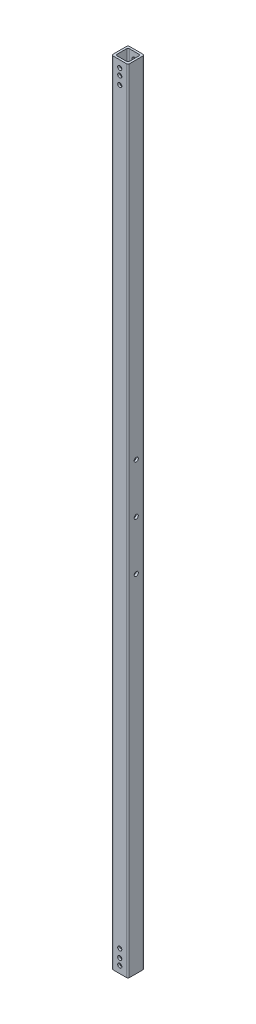
from build123d import *

# Parameters (mm, degrees)
SKETCH1_W           = 25.4
SKETCH1_H           = 25.4
SKETCH1_W_2         = 19.05
SKETCH1_H_2         = 19.05
BOSS_EXTRUDE1_DEPTH = 609.6
FILLET1_R           = 2.1082
SKETCH6_R           = 3.175
CUT_EXTRUDE5_DEPTH  = 611.261099858
SKETCH7_R           = 3.175
CUT_EXTRUDE6_DEPTH  = 611.261099858
SKETCH8_R           = 3.175
CUT_EXTRUDE7_DEPTH  = 611.261099858


with BuildPart() as part:
    # Sketch1 → Boss-Extrude1 (new, symmetric)
    with BuildSketch(Plane(origin=(0, 0, 0), x_dir=(1, 0, 0), z_dir=(0, 1, 0))):
        Rectangle(SKETCH1_W, SKETCH1_H)
        Rectangle(SKETCH1_W_2, SKETCH1_H_2, mode=Mode.SUBTRACT)
    extrude(amount=BOSS_EXTRUDE1_DEPTH, both=True)

    # Fillet1
    fillet1_edges = [part.edges().sort_by_distance(p)[0] for p in [
        (9.525, 0, -9.525),
        (-9.525, 0, -9.525),
        (-9.525, 0, 9.525),
        (9.525, 0, 9.525),
        (12.7, 0, -12.7),
        (-12.7, 0, -12.7),
        (-12.7, 0, 12.7),
        (12.7, 0, 12.7),
    ]]
    fillet(fillet1_edges, radius=FILLET1_R)

    # Sketch6 → Cut-Extrude5 (cut, through all)
    with BuildSketch(Plane(origin=(0, 0, -12.7), x_dir=(-1, 0, 0), z_dir=(0, 0, -1))):
        with Locations((0, -598.805)):
            Circle(SKETCH6_R)
        with Locations((0, -588.645)):
            Circle(SKETCH6_R)
        with Locations((0, -575.945)):
            Circle(SKETCH6_R)
        with Locations((0, 598.805)):
            Circle(SKETCH6_R)
        with Locations((0, 588.645)):
            Circle(SKETCH6_R)
        with Locations((0, 575.945)):
            Circle(SKETCH6_R)
    extrude(amount=-CUT_EXTRUDE5_DEPTH, mode=Mode.SUBTRACT)

    # Sketch7 → Cut-Extrude6 (cut, through all)
    with BuildSketch(Plane.ZY.offset(12.7)):
        Circle(SKETCH7_R)
    extrude(amount=-CUT_EXTRUDE6_DEPTH, mode=Mode.SUBTRACT)

    # Sketch8 → Cut-Extrude7 (cut, through all)
    with BuildSketch(Plane.ZY.offset(12.7)):
        with Locations((0, -76.2)):
            Circle(SKETCH8_R)
    cut_extrude7 = extrude(amount=-CUT_EXTRUDE7_DEPTH, mode=Mode.SUBTRACT)

    # Mirror1: Cut-Extrude7 across plane
    add(cut_extrude7.mirror(Plane.ZX), mode=Mode.SUBTRACT)


solid = part.part
